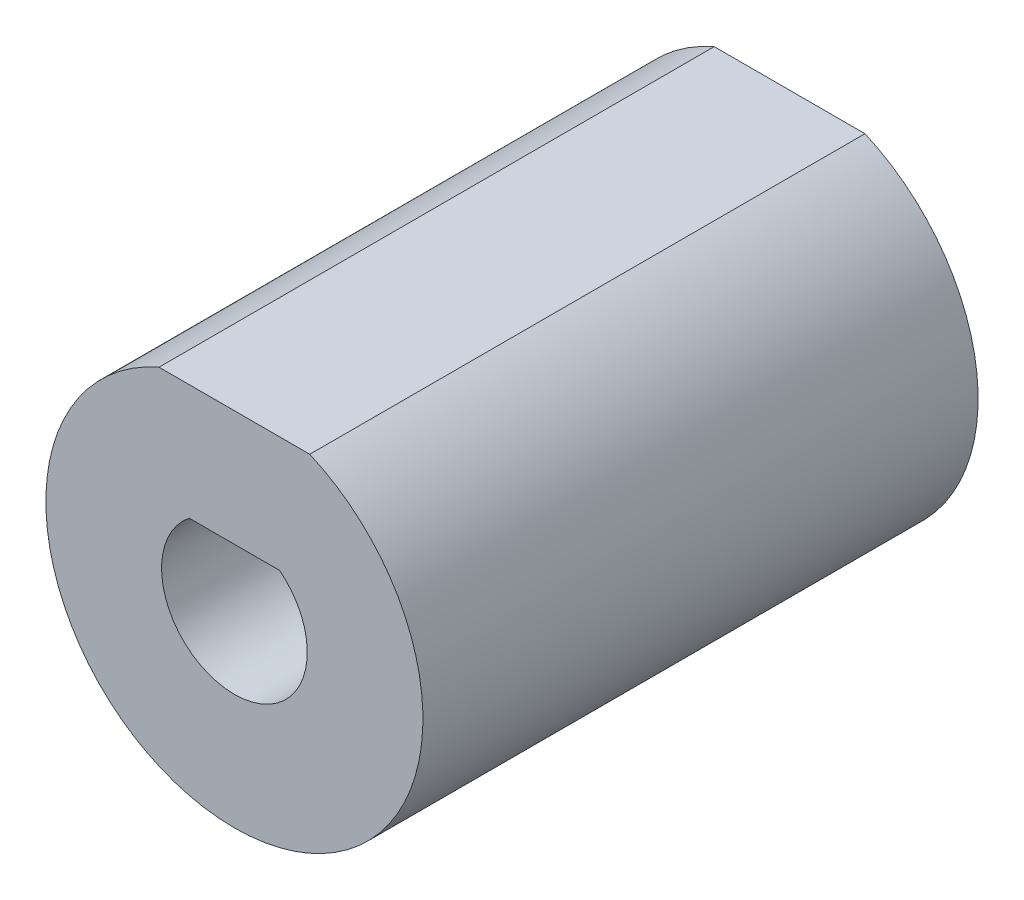
from build123d import *

# Parameters (mm, degrees)
BOSS_EXTRUDE1_DEPTH = 6.35
BOSS_EXTRUDE2_START = 2.54
BOSS_EXTRUDE2_DEPTH = 2.54
BOSS_EXTRUDE4_START = 6.35
SKETCH4_R           = 1.5113
BOSS_EXTRUDE4_DEPTH = 6.35


with BuildPart() as part:
    # Sketch1 → Boss-Extrude1 (new body)
    with BuildSketch(Plane.XY):
        with BuildLine():
            Line((-2.069463106, 4.743200128), (2.069463106, 4.743200128))
            ThreePointArc((2.069463106, 4.743200128), (0, -5.175), (-2.069463106, 4.743200128))
        make_face()
        with BuildLine():
            Line((-1.24126885, 1.568200128), (1.24126885, 1.568200128))
            ThreePointArc((1.24126885, 1.568200128), (0, -2), (-1.24126885, 1.568200128))
        make_face(mode=Mode.SUBTRACT)
    extrude(amount=BOSS_EXTRUDE1_DEPTH)

    # Sketch3 → Boss-Extrude2 (add)
    with BuildSketch(Plane(origin=(0, 0, 0), x_dir=(-1, 0, 0), z_dir=(0, 0, -1)).offset(BOSS_EXTRUDE2_START)):
        with BuildLine():
            Line((-2.069463106, 4.743200128), (2.069463106, 4.743200128))
            ThreePointArc((2.069463106, 4.743200128), (0, -5.175), (-2.069463106, 4.743200128))
        make_face()
    extrude(amount=-BOSS_EXTRUDE2_DEPTH)

    # Sketch4 → Boss-Extrude4 (add)
    with BuildSketch(Plane(origin=(0, 0, -2.54), x_dir=(-1, 0, 0), z_dir=(0, 0, -1)).offset(BOSS_EXTRUDE4_START)):
        with BuildLine():
            Line((2.069463106, 4.743200128), (-2.069463106, 4.743200128))
            ThreePointArc((-2.069463106, 4.743200128), (0, -5.175), (2.069463106, 4.743200128))
        make_face()
        Circle(SKETCH4_R, mode=Mode.SUBTRACT)
    extrude(amount=-BOSS_EXTRUDE4_DEPTH)


solid = part.part
